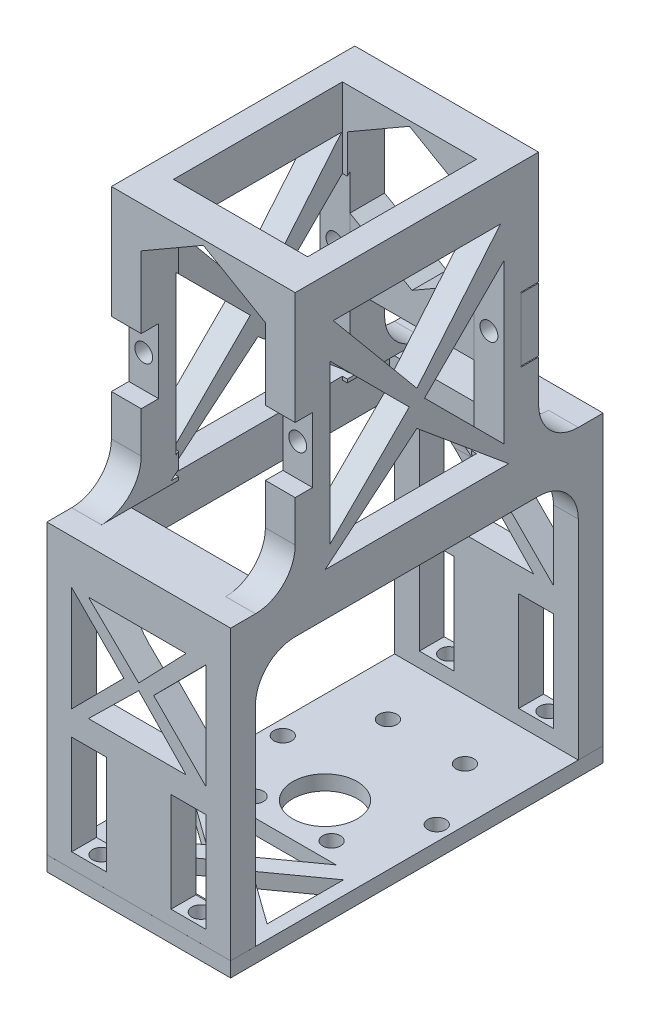
from build123d import *

# Parameters (mm, degrees)
SKETCH2_R               = 18.5
SKETCH2_R_2             = 1.8
BOSS_EXTRUDE1_DEPTH     = 3
SKETCH3_R               = 6.5
CUT_EXTRUDE1_DEPTH      = 3
BOSS_EXTRUDE2_START     = -3
BOSS_EXTRUDE2_DEPTH     = 3
SKETCH5_W               = 37
SKETCH5_H               = 5
BOSS_EXTRUDE3_DEPTH     = 90
SKETCH6_W               = 37
SKETCH6_H               = 15.5
BOSS_EXTRUDE4_DEPTH     = 5
SKETCH7_W               = 6
SKETCH7_H               = 20.5
BOSS_EXTRUDE5_DEPTH     = 20
SKETCH8_W               = 25
SKETCH8_H               = 15.5
CUT_EXTRUDE2_DEPTH      = 10
SKETCH9_W               = 25
SKETCH9_H               = 5
BOSS_EXTRUDE6_DEPTH     = 20
BOSS_EXTRUDE7_REACH     = 128.813
SKETCH10_W              = 5
SKETCH10_H              = 25
SKETCH11_W              = 25
SKETCH11_H              = 20
CUT_EXTRUDE3_DEPTH      = 137.880422267
SKETCH13_W              = 13
SKETCH13_H              = 60
CUT_EXTRUDE5_DEPTH      = 127.957670111
BOSS_EXTRUDE8_DEPTH     = 35
SKETCH16_W              = 37
SKETCH16_H              = 8
BOSS_EXTRUDE9_DEPTH     = 13
SKETCH17_W              = 37
SKETCH17_H              = 8
BOSS_EXTRUDE10_DEPTH    = 13
FILLET1_START           = -18.5
FILLET1_DEPTH           = 37
FILLET2_R               = 8
SKETCH18_W              = 37
SKETCH18_H              = 75
CUT_EXTRUDE6_DEPTH      = 0.001
SKETCH19_R              = 1.8
CUT_EXTRUDE7_DEPTH      = 6
SKETCH20_W              = 7
SKETCH20_H              = 5
CUT_EXTRUDE8_DEPTH      = 20
CUT_EXTRUDE9_DEPTH      = 127.957670111
CUT_EXTRUDE9_DEPTH_BACK = 127.957670111
CUT_EXTRUDE10_DEPTH     = 137.880422267
CUT_EXTRUDE11_DEPTH     = 15
BOSS_EXTRUDE11_DEPTH    = 7.5
BOSS_EXTRUDE12_DEPTH    = 7.5
SKETCH27_W              = 27
SKETCH27_H              = 53
CUT_EXTRUDE13_DEPTH     = 10
BOSS_EXTRUDE13_DEPTH    = 6.9930205
SKETCH29_W              = 6
SKETCH29_H              = 13.094091563
CUT_EXTRUDE14_DEPTH     = 3.5
SKETCH30_W              = 6
SKETCH30_H              = 12.694091563
BOSS_EXTRUDE14_DEPTH    = 3.5
CUT_EXTRUDE15_REACH     = 128.958
SKETCH31_W              = 3.5
SKETCH31_H              = 13.094091563
CUT_EXTRUDE16_START     = -6.993021
SKETCH32_R              = 1.8
CUT_EXTRUDE16_DEPTH     = 6.993021
SKETCH33_R              = 1.8
CUT_EXTRUDE17_DEPTH     = 3.4930205


with BuildPart() as part:
    # Sketch2 → Boss-Extrude1 (new body)
    with BuildSketch(Plane(origin=(0, 0, 0), x_dir=(1, 0, 0), z_dir=(0, 1, 0))):
        with Locations(Location((0, 0, 0), (0, 0, 270))):
            Circle(SKETCH2_R)
        with Locations(Location((-15.5, 0, 0), (0, 0, 270))):
            Circle(SKETCH2_R_2, mode=Mode.SUBTRACT)
        with Locations(Location((-7.75, 13.423393759, 0), (0, 0, 270))):
            Circle(SKETCH2_R_2, mode=Mode.SUBTRACT)
        with Locations(Location((7.75, 13.423393759, 0), (0, 0, 270))):
            Circle(SKETCH2_R_2, mode=Mode.SUBTRACT)
        with Locations(Location((15.5, 0, 0), (0, 0, 270))):
            Circle(SKETCH2_R_2, mode=Mode.SUBTRACT)
        with Locations(Location((7.75, -13.423393759, 0), (0, 0, 270))):
            Circle(SKETCH2_R_2, mode=Mode.SUBTRACT)
        with Locations(Location((-7.75, -13.423393759, 0), (0, 0, 270))):
            Circle(SKETCH2_R_2, mode=Mode.SUBTRACT)
    extrude(amount=BOSS_EXTRUDE1_DEPTH)

    # Sketch3 → Cut-Extrude1 (cut)
    with BuildSketch(Plane(origin=(0, 3, 0), x_dir=(1, 0, 0), z_dir=(0, 1, 0))):
        with Locations(Location((0, -7, 0), (0, 0, 270))):
            Circle(SKETCH3_R)
    extrude(amount=-CUT_EXTRUDE1_DEPTH, mode=Mode.SUBTRACT)

    # Sketch4 → Boss-Extrude2 (add)
    with BuildSketch(Plane(origin=(0, 3, 0), x_dir=(1, 0, 0), z_dir=(0, 1, 0)).offset(BOSS_EXTRUDE2_START)):
        with BuildLine():
            Line((18.5, 30.5), (-18.5, 30.5))
            Line((-18.5, 30.5), (-18.5, 0))
            ThreePointArc((-18.5, 0), (0, 18.5), (18.5, 0))
            Line((18.5, 0), (18.5, 30.5))
        make_face()
        with BuildLine():
            ThreePointArc((18.5, 0), (0, -18.5), (-18.5, 0))
            Line((-18.5, 0), (-18.5, -44.5))
            Line((-18.5, -44.5), (18.5, -44.5))
            Line((18.5, -44.5), (18.5, 0))
        make_face()
    extrude(amount=BOSS_EXTRUDE2_DEPTH)

    # Sketch5 → Boss-Extrude3 (add)
    with BuildSketch(Plane(origin=(0, 3, 0), x_dir=(1, 0, 0), z_dir=(0, 1, 0))):
        with Locations((0, 28)):
            Rectangle(SKETCH5_W, SKETCH5_H)
        with Locations((0, -42)):
            Rectangle(SKETCH5_W, SKETCH5_H)
    extrude(amount=BOSS_EXTRUDE3_DEPTH)

    # Sketch6 → Boss-Extrude4 (add)
    with BuildSketch(Plane(origin=(0, 93, 0), x_dir=(1, 0, 0), z_dir=(0, 1, 0))):
        with Locations((0, 17.75)):
            Rectangle(SKETCH6_W, SKETCH6_H)
        with Locations((0, -31.75)):
            Rectangle(SKETCH6_W, SKETCH6_H)
    extrude(amount=-BOSS_EXTRUDE4_DEPTH)

    # Sketch7 → Boss-Extrude5 (add)
    with BuildSketch(Plane(origin=(0, 93, 0), x_dir=(1, 0, 0), z_dir=(0, 1, 0))):
        with Locations((-15.5, 20.25)):
            Rectangle(SKETCH7_W, SKETCH7_H)
        with Locations((15.5, 20.25)):
            Rectangle(SKETCH7_W, SKETCH7_H)
        with Locations((-15.5, -34.25)):
            Rectangle(SKETCH7_W, SKETCH7_H)
        with Locations((15.5, -34.25)):
            Rectangle(SKETCH7_W, SKETCH7_H)
    extrude(amount=BOSS_EXTRUDE5_DEPTH)

    # Sketch8 → Cut-Extrude2 (cut)
    with BuildSketch(Plane(origin=(0, 93, 0), x_dir=(1, 0, 0), z_dir=(0, 1, 0))):
        with Locations((0, 17.75)):
            Rectangle(SKETCH8_W, SKETCH8_H)
        with Locations((0, -31.75)):
            Rectangle(SKETCH8_W, SKETCH8_H)
    extrude(amount=-CUT_EXTRUDE2_DEPTH, mode=Mode.SUBTRACT)

    # Sketch9 → Boss-Extrude6 (add)
    with BuildSketch(Plane(origin=(0, 93, 0), x_dir=(1, 0, 0), z_dir=(0, 1, 0))):
        with Locations((0, 28)):
            Rectangle(SKETCH9_W, SKETCH9_H)
        with Locations((0, -42)):
            Rectangle(SKETCH9_W, SKETCH9_H)
    extrude(amount=BOSS_EXTRUDE6_DEPTH)

    # Sketch10 → Boss-Extrude7 (add, up to next)
    with BuildSketch(Plane(origin=(0, 0, 24), x_dir=(-1, 0, 0), z_dir=(0, 0, -1)), mode=Mode.PRIVATE) as boss_extrude7_sk1:
        with Locations((16, 100.5)):
            Rectangle(SKETCH10_W, SKETCH10_H)
    boss_extrude7_tool1 = extrude(boss_extrude7_sk1.sketch, amount=BOSS_EXTRUDE7_REACH, mode=Mode.PRIVATE) - part.part
    # Sketch10 → Boss-Extrude7 (add, up to next)
    with BuildSketch(Plane(origin=(0, 0, 24), x_dir=(-1, 0, 0), z_dir=(0, 0, -1)), mode=Mode.PRIVATE) as boss_extrude7_sk2:
        with Locations((-16, 100.5)):
            Rectangle(SKETCH10_W, SKETCH10_H)
    boss_extrude7_tool2 = extrude(boss_extrude7_sk2.sketch, amount=BOSS_EXTRUDE7_REACH, mode=Mode.PRIVATE) - part.part
    add(boss_extrude7_tool1.solids().sort_by_distance((-16, 100.5, 24))[0])
    add(boss_extrude7_tool2.solids().sort_by_distance((16, 100.5, 24))[0])

    # Sketch11 → Cut-Extrude3 (cut, through all)
    with BuildSketch(Plane.XY.offset(44.5)):
        with Locations((0, 103)):
            Rectangle(SKETCH11_W, SKETCH11_H)
    extrude(amount=-CUT_EXTRUDE3_DEPTH, mode=Mode.SUBTRACT)

    # Sketch13 → Cut-Extrude5 (cut, through all)
    with BuildSketch(Plane(origin=(18.5, 0, 0), x_dir=(0, 0, -1), z_dir=(1, 0, 0))):
        with Locations((-38, 83)):
            Rectangle(SKETCH13_W, SKETCH13_H)
        with Locations((24, 83)):
            Rectangle(SKETCH13_W, SKETCH13_H)
    extrude(amount=-CUT_EXTRUDE5_DEPTH, mode=Mode.SUBTRACT)


with BuildPart() as cut_extrude5_piece_1:
    # of the separate pieces the step leaves, piece 1, a body of its own (cut_extrude5_pieces)
    add(part.part.solids().sort_by_distance((-7.75, 0, 15.223393759))[0])



with BuildPart() as cut_extrude5_piece_2:
    # of the separate pieces the step leaves, piece 2, a body of its own (cut_extrude5_pieces)
    add(part.part.solids().sort_by_distance((-18.5, 113, 31.5))[0])



with BuildPart() as cut_extrude5_piece_3:
    # of the separate pieces the step leaves, piece 3, a body of its own (cut_extrude5_pieces)
    add(part.part.solids().sort_by_distance((18.5, 113, 31.5))[0])


with BuildPart() as cut_extrude5_piece_2_1:
    add(cut_extrude5_piece_2.part)

    add(cut_extrude5_piece_3.part)  # Boss-Extrude8 merges Cut-Extrude5 piece 3
    # Sketch14 → Boss-Extrude8 (add)
    with BuildSketch(Plane.XZ.offset(-88)):
        Polygon((18.5, -17.5), (18.5, 31.5), (12.5, 31.5), (12.5, 24), (13.5, 24), (13.5, -10), (12.5, -10), (12.5, -17.5), align=None)
        Polygon((-12.5, 31.5), (-18.5, 31.5), (-18.5, -17.5), (-12.5, -17.5), (-12.5, -10), (-13.5, -10), (-13.5, 24), (-12.5, 24), align=None)
    extrude(amount=BOSS_EXTRUDE8_DEPTH)


with BuildPart() as cut_extrude5_piece_1_1:
    add(cut_extrude5_piece_1.part)

    add(cut_extrude5_piece_2_1.part)  # Boss-Extrude9 merges Cut-Extrude5 piece 2
    # Sketch16 → Boss-Extrude9 (add)
    with BuildSketch(Plane.XY.offset(31.5)):
        with Locations((0, 57)):
            Rectangle(SKETCH16_W, SKETCH16_H)
    extrude(amount=BOSS_EXTRUDE9_DEPTH)

    # Sketch17 → Boss-Extrude10 (add)
    with BuildSketch(Plane(origin=(0, 0, -17.5), x_dir=(-1, 0, 0), z_dir=(0, 0, -1))):
        with Locations((0, 57)):
            Rectangle(SKETCH17_W, SKETCH17_H)
    extrude(amount=BOSS_EXTRUDE10_DEPTH)

    # Fillet1: read off the stored shape, not the designer's step
    # Fillet1 outline → Fillet1 (add)
    with BuildSketch(Plane.YZ.offset(FILLET1_START)):
        with BuildLine():
            ThreePointArc((45, 39.5), (50.656854249, 37.156854249), (53, 31.5))
            Line((53, 31.5), (53, 39.5))
            Line((53, 39.5), (45, 39.5))
        make_face()
        with BuildLine():
            ThreePointArc((53, -17.5), (50.656854249, -23.156854249), (45, -25.5))
            Line((45, -25.5), (53, -25.5))
            Line((53, -25.5), (53, -17.5))
        make_face()
    extrude(amount=FILLET1_DEPTH)

    # Fillet2
    fillet2_edges = [cut_extrude5_piece_1_1.edges().sort_by_distance(p)[0] for p in [
        (15.5, 61, 31.5),
        (-15.5, 61, 31.5),
        (-15.5, 61, -17.5),
        (15.5, 61, -17.5),
    ]]
    fillet(fillet2_edges, radius=FILLET2_R)

    # Sketch18 → Cut-Extrude6 (cut)
    with BuildSketch(Plane(origin=(0, 3, 0), x_dir=(1, 0, 0), z_dir=(0, 1, 0))):
        with Locations((0, -7)):
            Rectangle(SKETCH18_W, SKETCH18_H)
    extrude(amount=CUT_EXTRUDE6_DEPTH, mode=Mode.SUBTRACT)


with BuildPart() as cut_extrude6_piece_1:
    # of the separate pieces the step leaves, piece 1, a body of its own (cut_extrude6_pieces)
    add(cut_extrude5_piece_1_1.part.solids().sort_by_distance((18.5, 61, 39.5))[0])


with BuildPart() as cut_extrude6_piece_2:
    # of the separate pieces the step leaves, piece 2, a body of its own (cut_extrude6_pieces)
    add(cut_extrude5_piece_1_1.part.solids().sort_by_distance((18.5, 3, 44.5))[0])


with BuildPart() as cut_extrude7_tool:
    # Sketch19 → Cut-Extrude7 (new body)
    with BuildSketch(Plane.XZ):
        with Locations(Location((-10, 42, 0), (0, 0, 270))):
            Circle(SKETCH19_R)
        with Locations(Location((10, 42, 0), (0, 0, 270))):
            Circle(SKETCH19_R)
        with Locations(Location((-10, -28, 0), (0, 0, 270))):
            Circle(SKETCH19_R)
        with Locations(Location((10, -28, 0), (0, 0, 270))):
            Circle(SKETCH19_R)
    extrude(amount=-CUT_EXTRUDE7_DEPTH)


with BuildPart() as cut_extrude6_piece_1_1:
    add(cut_extrude6_piece_1.part)

    # Cut-Extrude7: cut by cut_extrude7_tool
    add(cut_extrude7_tool.part, mode=Mode.SUBTRACT)

    # Sketch20 → Cut-Extrude8 (cut)
    with BuildSketch(Plane.XZ.offset(-6)):
        with Locations((-10, 42)):
            Rectangle(SKETCH20_W, SKETCH20_H)
        with Locations((10, 42)):
            Rectangle(SKETCH20_W, SKETCH20_H)
        with Locations((-10, -28)):
            Rectangle(SKETCH20_W, SKETCH20_H)
        with Locations((10, -28)):
            Rectangle(SKETCH20_W, SKETCH20_H)
    extrude(amount=-CUT_EXTRUDE8_DEPTH, mode=Mode.SUBTRACT)

    # Sketch21 → Cut-Extrude9 (cut, two sides: drawn at the far end of the back side and taken through both)
    with BuildSketch(Plane.ZY.offset(18.5).offset(-CUT_EXTRUDE9_DEPTH_BACK)):
        Polygon((-10.5069795, 97.546881465), (-10.5069795, 65.615135764), (5.458893351, 81.581008614), align=None)
        Polygon((24.5069795, 65.615135764), (8.541106649, 81.581008614), (24.5069795, 97.546881465), align=None)
        Polygon((-11.485209662, 61.67963441), (25.485209662, 61.67963441), (7, 77.078778227), align=None)
        Polygon((-9.842977491, 104.297173092), (23.842977491, 104.297173092), (7, 84.078778227), align=None)
    extrude(amount=CUT_EXTRUDE9_DEPTH + CUT_EXTRUDE9_DEPTH_BACK, mode=Mode.SUBTRACT)

    # Sketch22 → Cut-Extrude10 (cut, through all)
    with BuildSketch(Plane(origin=(0, 0, -30.5), x_dir=(-1, 0, 0), z_dir=(0, 0, -1))):
        Polygon((-13.5, 52.097217271), (-3, 41.509793962), (-13.5, 30.922370653), align=None)
        Polygon((3, 41.509793962), (13.5, 30.922370653), (13.5, 52.097217271), align=None)
        Polygon((-9.527716063, 30.922370653), (10.12909946, 30.922370653), (0, 40.845941529), align=None)
        Polygon((10.12909946, 52.097217271), (0, 42.173646395), (-9.527716063, 52.097217271), align=None)
    extrude(amount=-CUT_EXTRUDE10_DEPTH, mode=Mode.SUBTRACT)

    # Sketch25 → Boss-Extrude11 (add)
    with BuildSketch(Plane(origin=(0, 0, -17.5), x_dir=(-1, 0, 0), z_dir=(0, 0, -1))):
        Polygon((-12.5, 113), (12.5, 113), (12.5, 104.783121635), (0, 112), (-12.5, 104.783121635), align=None)
    extrude(amount=-BOSS_EXTRUDE11_DEPTH)

    # Sketch26 → Boss-Extrude12 (add)
    with BuildSketch(Plane.XY.offset(31.5)):
        Polygon((0, 112), (-12.5, 104.783121635), (-12.5, 113), (12.5, 113), (12.5, 104.783121635), align=None)
    extrude(amount=-BOSS_EXTRUDE12_DEPTH)

    # Sketch27 → Cut-Extrude13 (cut)
    with BuildSketch(Plane(origin=(0, 61, 0), x_dir=(1, 0, 0), z_dir=(0, 1, 0))):
        with Locations((0, -7)):
            Rectangle(SKETCH27_W, SKETCH27_H)
    extrude(amount=-CUT_EXTRUDE13_DEPTH, mode=Mode.SUBTRACT)

    # Sketch29 → Cut-Extrude14 (cut)
    with BuildSketch(Plane(origin=(0, 0, -17.5), x_dir=(-1, 0, 0), z_dir=(0, 0, -1))):
        with Locations((-15.5, 83.806075854)):
            Rectangle(SKETCH29_W, SKETCH29_H)
        with Locations((15.5, 83.806075854)):
            Rectangle(SKETCH29_W, SKETCH29_H)
    extrude(amount=-CUT_EXTRUDE14_DEPTH, mode=Mode.SUBTRACT)

    # Cut-Extrude15: up to this face of the body (flat: up to its plane)
    cut_extrude15_end = Plane(cut_extrude6_piece_1_1.part.faces().sort_by_distance((-18.5, 59.668655567, -28))[0])
    # Sketch31 → Cut-Extrude15 (cut, up to the picked face)
    with BuildSketch(Plane(origin=(18.5, 0, 0), x_dir=(0, 0, -1), z_dir=(1, 0, 0)), mode=Mode.PRIVATE) as cut_extrude15_sk1:
        with Locations((-29.75, 83.806075854)):
            Rectangle(SKETCH31_W, SKETCH31_H)
    cut_extrude15_tool1 = split(extrude(cut_extrude15_sk1.sketch, amount=-CUT_EXTRUDE15_REACH, mode=Mode.PRIVATE), bisect_by=cut_extrude15_end, keep=Keep.BOTH, mode=Mode.PRIVATE)
    add(cut_extrude15_tool1.solids().sort_by(Axis((18.5, 83.806076, 29.75), (-1, 0, 0)))[0], mode=Mode.SUBTRACT)


with BuildPart() as cut_extrude6_piece_2_1:
    add(cut_extrude6_piece_2.part)

    # Cut-Extrude7: cut by cut_extrude7_tool
    add(cut_extrude7_tool.part, mode=Mode.SUBTRACT)

    # Sketch23 → Cut-Extrude11 (cut)
    with BuildSketch(Plane.XZ):
        Polygon((-11.504954321, 36.262601208), (12.40534205, 36.262601208), (0.450193865, 27.658896237), align=None)
        Polygon((0.450193865, 25.758077697), (-11.504954321, 17.154372727), (12.40534205, 17.154372727), align=None)
        Polygon((-14.846233134, 34.405096401), (-14.846233134, 19.011877534), (-4.15152584, 26.708486967), align=None)
        Polygon((15.746620863, 19.011877534), (5.051913569, 26.708486967), (15.746620863, 34.405096401), align=None)
    extrude(amount=-CUT_EXTRUDE11_DEPTH, mode=Mode.SUBTRACT)


with BuildPart() as body_3:
    # Sketch28 → Boss-Extrude13 (new body)
    with BuildSketch(Plane(origin=(0, 0, -17.5), x_dir=(-1, 0, 0), z_dir=(0, 0, -1))):
        Polygon((-12.5, 90.353121635), (0, 83.143759666), (12.5, 90.353121635), (12.5, 77.259030072), (-12.5, 77.259030072), align=None)
    extrude(amount=-BOSS_EXTRUDE13_DEPTH)

    # Sketch30 → Boss-Extrude14 (add)
    with BuildSketch(Plane(origin=(0, 0, -17.5), x_dir=(-1, 0, 0), z_dir=(0, 0, -1))):
        with Locations((-15.5, 83.806075854)):
            Rectangle(SKETCH30_W, SKETCH30_H)
        with Locations((15.5, 83.806075854)):
            Rectangle(SKETCH30_W, SKETCH30_H)
    extrude(amount=-BOSS_EXTRUDE14_DEPTH)


with BuildPart() as cut_extrude16_tool:
    # Sketch32 → Cut-Extrude16 (new body)
    with BuildSketch(Plane(origin=(0, 0, -17.5), x_dir=(-1, 0, 0), z_dir=(0, 0, -1)).offset(CUT_EXTRUDE16_START)):
        with Locations((-15.5, 83.806075854)):
            Circle(SKETCH32_R)
        with Locations(Location((15.5, 83.806075854, 0), (0, 0, 180))):
            Circle(SKETCH32_R)
    extrude(amount=CUT_EXTRUDE16_DEPTH)


with BuildPart() as cut_extrude6_piece_1_2:
    add(cut_extrude6_piece_1_1.part)

    # Cut-Extrude16: cut by cut_extrude16_tool
    add(cut_extrude16_tool.part, mode=Mode.SUBTRACT)

    # Sketch33 → Cut-Extrude17 (cut)
    with BuildSketch(Plane.XY.offset(28)):
        with Locations((-15.5, 83.806075854)):
            Circle(SKETCH33_R)
        with Locations(Location((15.5, 83.806075854, 0), (0, 0, 180))):
            Circle(SKETCH33_R)
    extrude(amount=-CUT_EXTRUDE17_DEPTH, mode=Mode.SUBTRACT)


with BuildPart() as body_3_1:
    add(body_3.part)

    # Cut-Extrude16: cut by cut_extrude16_tool
    add(cut_extrude16_tool.part, mode=Mode.SUBTRACT)


solid = Compound([cut_extrude6_piece_2_1.part, cut_extrude6_piece_1_2.part, body_3_1.part])
